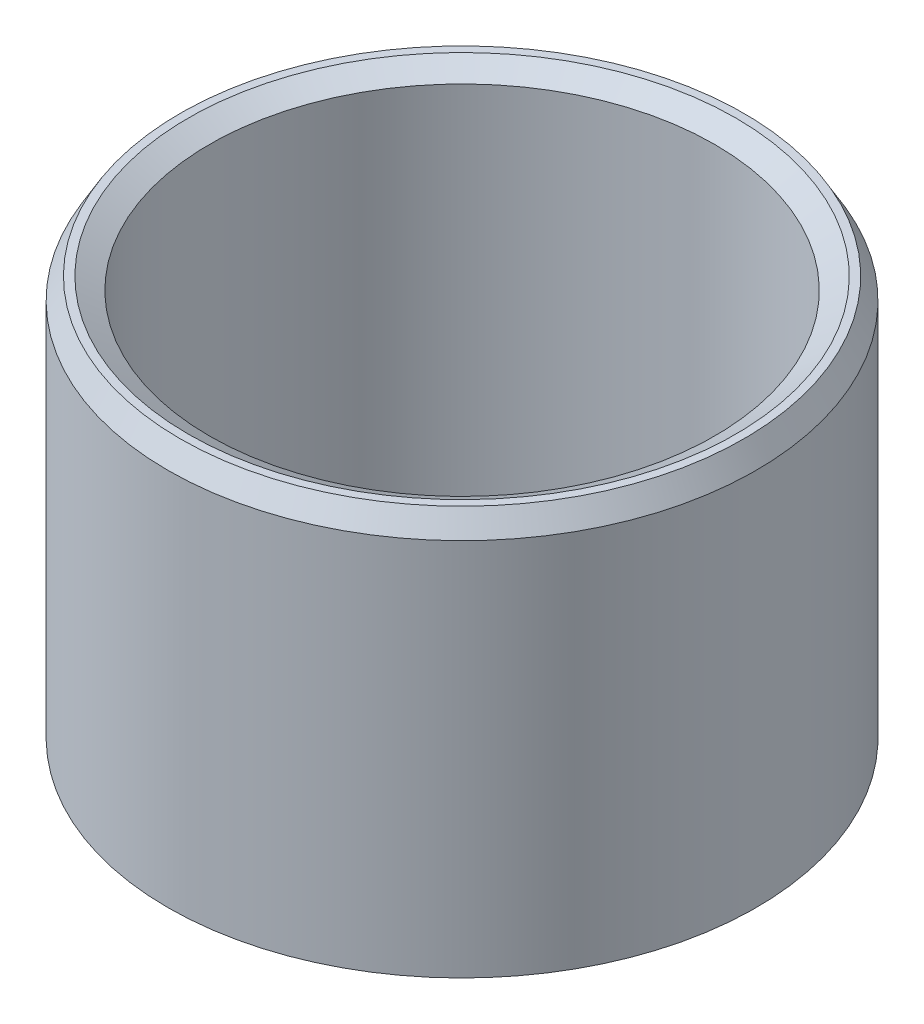
from build123d import *
from OCP.BRepFilletAPI import BRepFilletAPI_MakeChamfer

# Parameters (mm, degrees)
SKETCH1_R           = 35
BOSS_EXTRUDE1_DEPTH = 49.044141402
SKETCH2_R           = 30.059542103
CUT_EXTRUDE1_DEPTH  = 70.680182304
CHAMFER1_SIZE       = 2.521565983
CHAMFER1_SIZE2      = 1.455826799


with BuildPart() as part:
    # Sketch1 → Boss-Extrude1 (new body)
    with BuildSketch(Plane(origin=(0, 0, 0), x_dir=(1, 0, 0), z_dir=(0, 1, 0))):
        Circle(SKETCH1_R)
    extrude(amount=BOSS_EXTRUDE1_DEPTH)

    # Sketch2 → Cut-Extrude1 (cut, through all)
    with BuildSketch(Plane(origin=(0, 0, 0), x_dir=(1, 0, 0), z_dir=(0, 1, 0))):
        Circle(SKETCH2_R)
    extrude(amount=CUT_EXTRUDE1_DEPTH, mode=Mode.SUBTRACT)

    # Chamfer1: one chamfer whose edges measure the first distance from different faces: ONE call of the kernel's chamfer builder (chamfer() names one face for all edges)
    chamfer1_edges_1 = [part.edges().sort_by_distance(p)[0] for p in [
        (-30.059542103, 49.044141402, 0),
    ]]
    chamfer1_side_1 = [part.faces().sort_by_distance(p)[0] for p in [
        (-34.010050506, 49.044141402, 0),
    ]]
    chamfer1_edges_2 = [part.edges().sort_by_distance(p)[0] for p in [
        (-30.059542103, 0, 0),
    ]]
    chamfer1_side_2 = [part.faces().sort_by_distance(p)[0] for p in [
        (-30.059542103, 24.522070701, 0),
    ]]
    chamfer1_edges_3 = [part.edges().sort_by_distance(p)[0] for p in [
        (-35, 0, 0),
    ]]
    chamfer1_side_3 = [part.faces().sort_by_distance(p)[0] for p in [
        (-34.010050506, 0, 0),
    ]]
    chamfer1_edges_4 = [part.edges().sort_by_distance(p)[0] for p in [
        (-35, 49.044141402, 0),
    ]]
    chamfer1_side_4 = [part.faces().sort_by_distance(p)[0] for p in [
        (-35, 24.522070701, 0),
    ]]
    chamfer1 = BRepFilletAPI_MakeChamfer(part.part.solid().wrapped)
    for e in chamfer1_edges_1:
        chamfer1.Add(CHAMFER1_SIZE, CHAMFER1_SIZE2, e.wrapped, chamfer1_side_1[0].wrapped)  # the first distance lies on this face
    for e in chamfer1_edges_2:
        chamfer1.Add(CHAMFER1_SIZE, CHAMFER1_SIZE2, e.wrapped, chamfer1_side_2[0].wrapped)  # the first distance lies on this face
    for e in chamfer1_edges_3:
        chamfer1.Add(CHAMFER1_SIZE, CHAMFER1_SIZE2, e.wrapped, chamfer1_side_3[0].wrapped)  # the first distance lies on this face
    for e in chamfer1_edges_4:
        chamfer1.Add(CHAMFER1_SIZE, CHAMFER1_SIZE2, e.wrapped, chamfer1_side_4[0].wrapped)  # the first distance lies on this face
    add(Compound.cast(chamfer1.Shape()), mode=Mode.REPLACE)


solid = part.part
